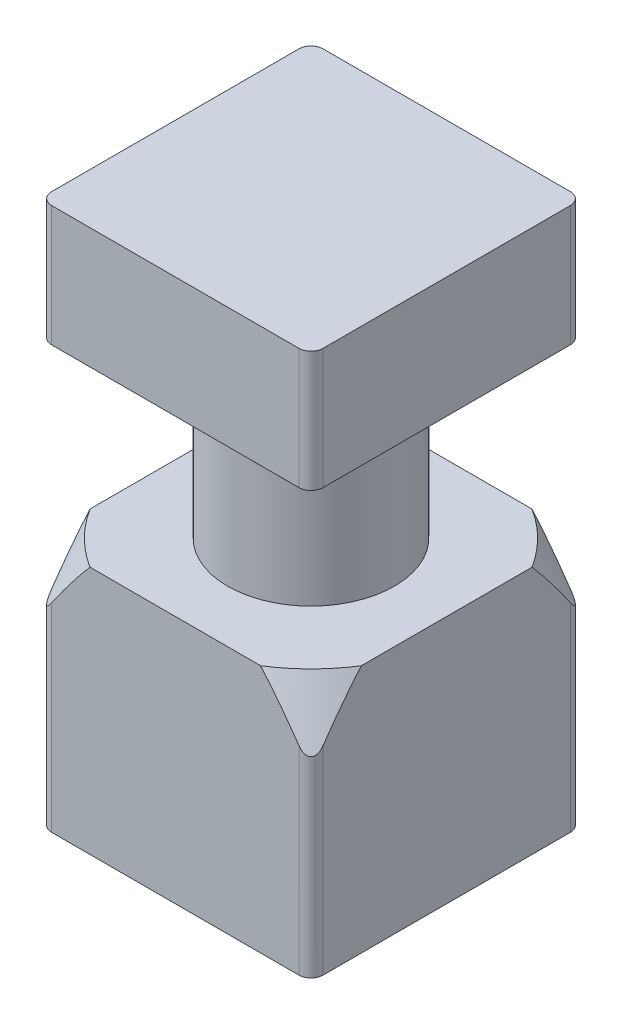
from build123d import *

# Parameters (mm, degrees)
SKETCH1_W           = 28.575
SKETCH1_H           = 28.575
BOSS_EXTRUDE1_DEPTH = 57.15
FILLET2_R           = 1.27


with BuildPart() as part:
    # Sketch1 → Boss-Extrude1 (new body)
    with BuildSketch(Plane(origin=(0, 0, 0), x_dir=(1, 0, 0), z_dir=(0, 1, 0))):
        Rectangle(SKETCH1_W, SKETCH1_H)
    extrude(amount=BOSS_EXTRUDE1_DEPTH)

    # Sketch4 → Cut-Revolve3 (revolve, cut)
    with BuildSketch(Plane(origin=(0, 0, 0), x_dir=(0.7071067811865477, 0, 0.7071067811865475), z_dir=(-0.7071067811865475, 0, 0.7071067811865477))):
        Polygon((8.775576272, 44.45), (8.775576272, 26.19375), (16.874390939, 26.19375), (20.205576272, 19.05), (20.205576272, 44.45), align=None)
    cut_revolve3 = revolve(axis=Axis((0, 52.5, 0), (0, -1, 0)), mode=Mode.SUBTRACT)

    # Fillet2
    fillet2_edges = [part.edges().sort_by_distance(p)[0] for p in [
        (14.2875, 9.525, -14.2875),
        (14.2875, 50.8, -14.2875),
        (-14.2875, 9.525, -14.2875),
        (-14.2875, 9.525, 14.2875),
        (14.2875, 9.525, 14.2875),
        (14.2875, 50.8, 14.2875),
        (-14.2875, 50.8, 14.2875),
        (-14.2875, 50.8, -14.2875),
    ]]
    fillet(fillet2_edges, radius=FILLET2_R)

    # Mirror1: Cut-Revolve3 across plane
    add(cut_revolve3.mirror(Plane.XY), mode=Mode.SUBTRACT)


solid = part.part
